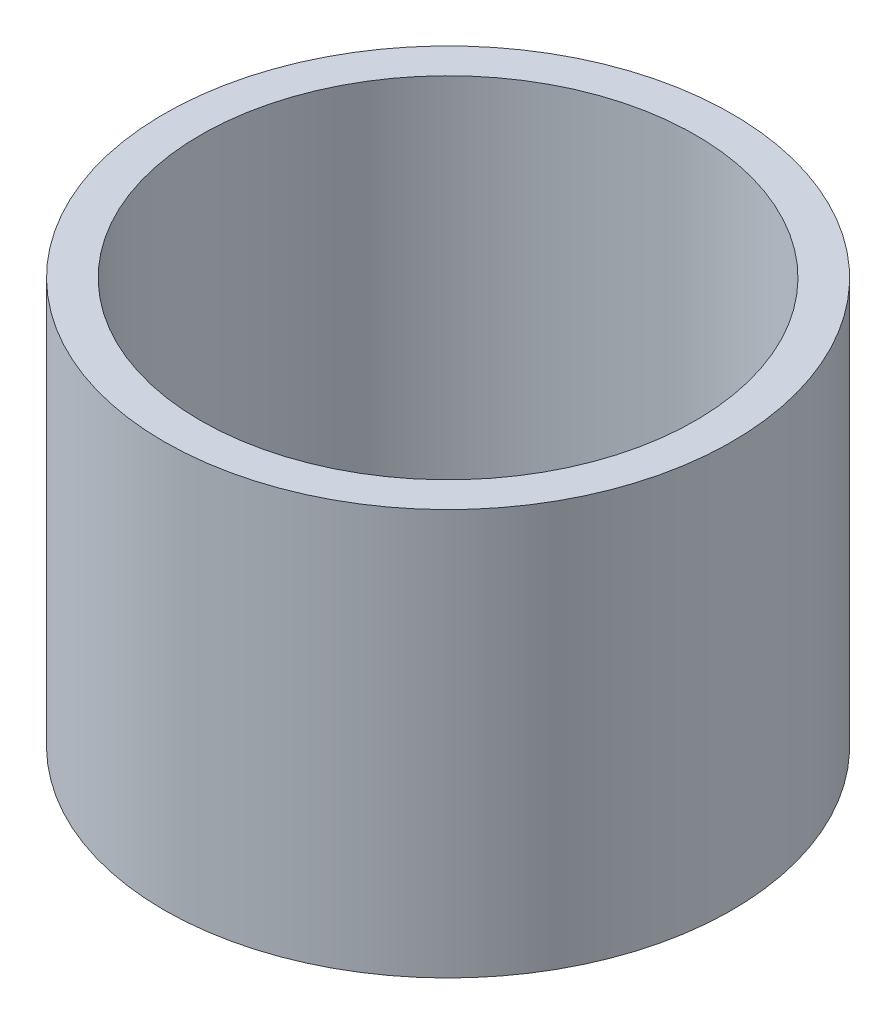
from build123d import *

# Parameters (mm, degrees)
SKETCH1_R           = 3.5
SKETCH1_R_2         = 3.05
BOSS_EXTRUDE1_DEPTH = 5


with BuildPart() as part:
    # Sketch1 → Boss-Extrude1 (new body)
    with BuildSketch(Plane(origin=(0, 0, 0), x_dir=(1, 0, 0), z_dir=(0, 1, 0))):
        Circle(SKETCH1_R)
        Circle(SKETCH1_R_2, mode=Mode.SUBTRACT)
    extrude(amount=BOSS_EXTRUDE1_DEPTH)


solid = part.part
